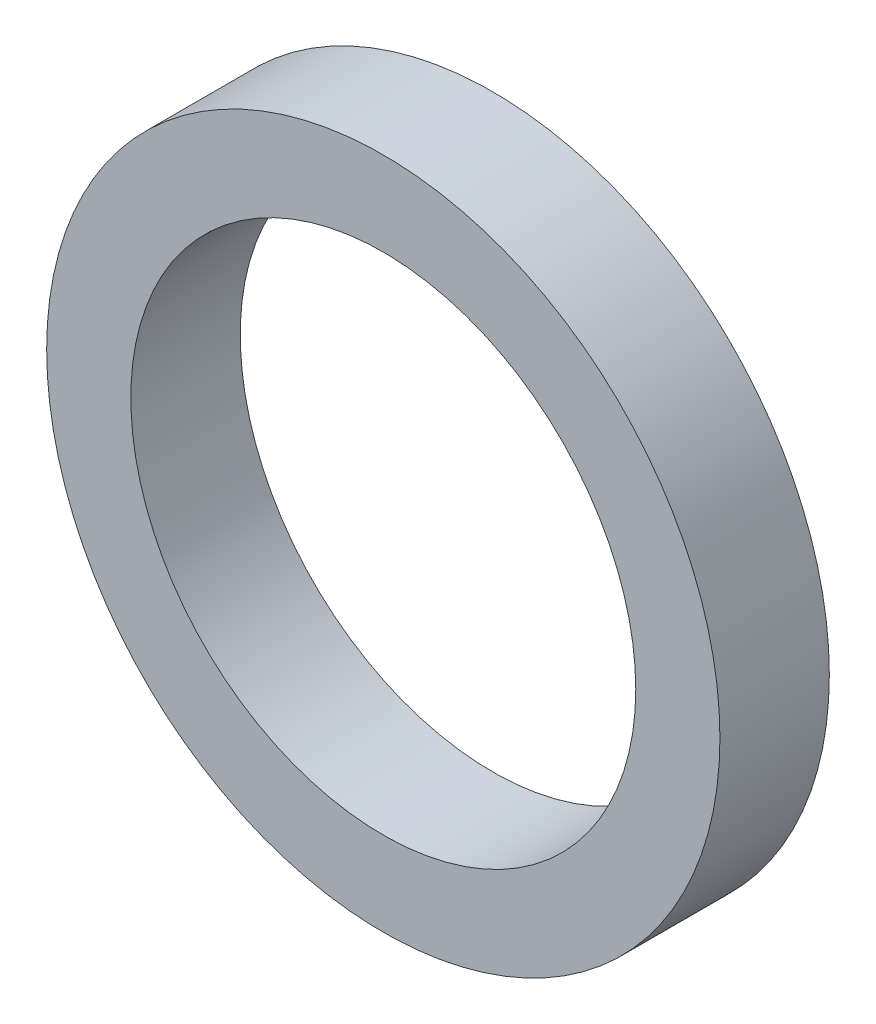
from build123d import *

# Parameters (mm, degrees)
SZKIC1_R                    = 8
SZKIC1_R_2                  = 6
DODANIE_WYCI_GNI_CIE1_DEPTH = 2.6


with BuildPart() as part:
    # Szkic1 → Dodanie-wyciągnięcie1 (new body)
    with BuildSketch(Plane.XY):
        Circle(SZKIC1_R)
        Circle(SZKIC1_R_2, mode=Mode.SUBTRACT)
    extrude(amount=DODANIE_WYCI_GNI_CIE1_DEPTH)


solid = part.part
